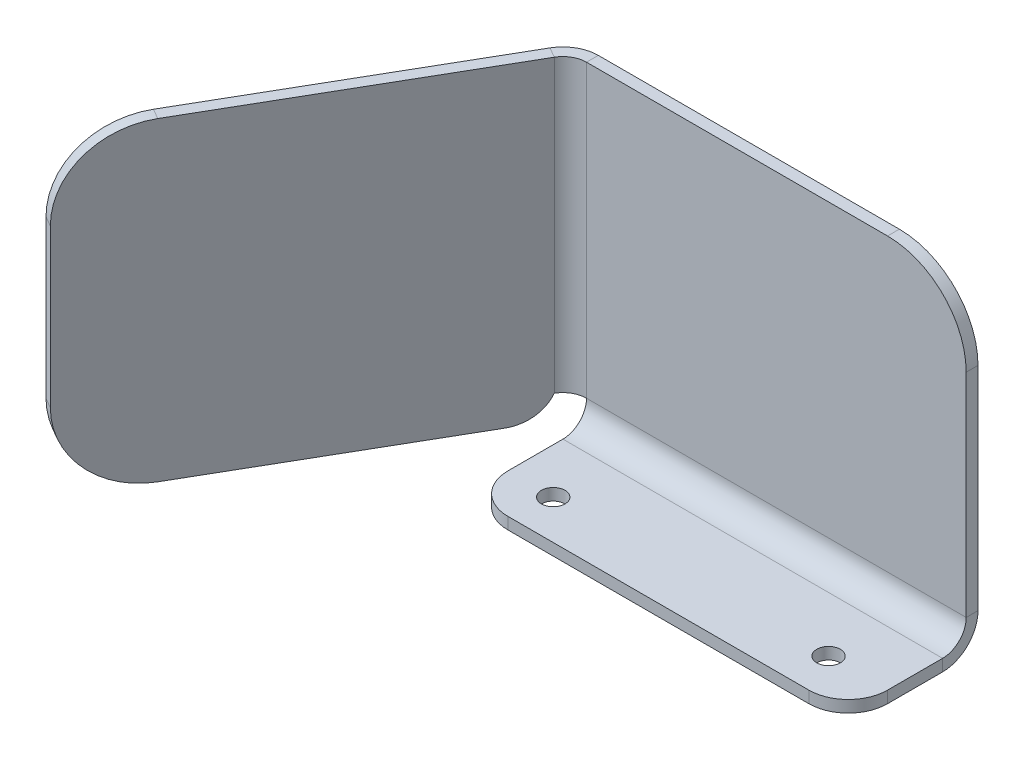
from build123d import *

# Parameters (mm, degrees)
SKETCH1_W                    = 50
SKETCH1_H                    = 40
BASE_FLANGE1_DEPTH           = 1.5
EDGE_FLANGE1_STRIP_CUT_DEPTH = 40
EDGE_FLANGE1_DEPTH           = 40
EDGE_FLANGE2_START           = -25.866025404
EDGE_FLANGE2_DEPTH           = 2.598076212
EDGE_FLANGE2_START_2         = -23.267949192
EDGE_FLANGE2_2_DEPTH         = 48.267949192
EDGE_FLANGE2_3_DEPTH         = 50.866025404
EDGE_FLANGE2_START_3         = -21
EDGE_FLANGE2_4_DEPTH         = 4
SKETCH12_R                   = 1.5
CUT_EXTRUDE1_DEPTH           = 10
FILLET1_R                    = 10
FILLET2_R                    = 5


with BuildPart() as part:
    # Base-Flange1: sheet metal written as solids
    # Sketch1 → Base-Flange1 (new body)
    with BuildSketch(Plane.XY):
        Rectangle(SKETCH1_W, SKETCH1_H)
    extrude(amount=BASE_FLANGE1_DEPTH)

    # Edge-Flange1: sheet metal written as solids
    # Edge-Flange1 strip (on a plane across the edge) → Edge-Flange1 strip cut (cut)
    with BuildSketch(Plane(origin=(-25, 20, 1.5), x_dir=(0.8660254037844364, 0, 0.5000000000000041), z_dir=(0, -1, 0))):
        Polygon((-9.642304845, 3.834936491), (0.75, -2.165063509), (1.5, -0.866025404), (-8.892304845, 5.133974596), align=None)
    extrude(amount=EDGE_FLANGE1_STRIP_CUT_DEPTH, mode=Mode.SUBTRACT)

    # Edge-Flange1 section (on a plane across the edge) → Edge-Flange1 (add)
    with BuildSketch(Plane(origin=(-25, 20, 1.5), x_dir=(0.8660254037844364, 0, 0.5000000000000041), z_dir=(0, -1, 0))):
        with BuildLine():
            Line((-1.5, 1.732050808), (-1.5, 48.633974596))
            Line((-1.5, 48.633974596), (0, 48.633974596))
            Line((0, 48.633974596), (0, 1.732050808))
            ThreePointArc((0, 1.732050808), (0.401923789, 0.232050808), (1.5, -0.866025404))
            Line((1.5, -0.866025404), (0.75, -2.165063509))
            ThreePointArc((0.75, -2.165063509), (-0.897114317, -0.517949192), (-1.5, 1.732050808))
        make_face()
    extrude(amount=EDGE_FLANGE1_DEPTH)

    # Edge-Flange2: read off the stored shape, not the designer's step
    # Edge-Flange2 outline → Edge-Flange2 (cut)
    with BuildSketch(Plane.YZ.offset(EDGE_FLANGE2_START)):
        with BuildLine():
            Line((-17, 0), (-17, 1.5))
            ThreePointArc((-17, 1.5), (-19.121320344, 2.378679656), (-20, 4.5))
            Line((-20, 4.5), (-20, 16.5))
            Line((-20, 16.5), (-21.5, 16.5))
            Line((-21.5, 16.5), (-21.5, 4.5))
            ThreePointArc((-21.5, 4.5), (-21.107919181, 2.662882693), (-20, 1.145898034))
            ThreePointArc((-20, 1.145898034), (-18.605699404, 0.296224385), (-17, 0))
        make_face()
    extrude(amount=EDGE_FLANGE2_DEPTH, mode=Mode.SUBTRACT)

    # Edge-Flange2 2 outline → Edge-Flange2 2 (add)
    with BuildSketch(Plane.YZ.offset(EDGE_FLANGE2_START_2)):
        with BuildLine():
            Line((-17, 0), (-17, 1.5))
            ThreePointArc((-17, 1.5), (-19.121320344, 2.378679656), (-20, 4.5))
            Line((-20, 4.5), (-20, 16.5))
            Line((-20, 16.5), (-21.5, 16.5))
            Line((-21.5, 16.5), (-21.5, 4.5))
            ThreePointArc((-21.5, 4.5), (-21.107919181, 2.662882693), (-20, 1.145898034))
            ThreePointArc((-20, 1.145898034), (-18.605699404, 0.296224385), (-17, 0))
        make_face()
    extrude(amount=EDGE_FLANGE2_2_DEPTH)

    # Edge-Flange2 3 outline → Edge-Flange2 3 (cut)
    with BuildSketch(Plane.YZ.offset(EDGE_FLANGE2_START)):
        with BuildLine():
            ThreePointArc((-17, 0), (-18.605699404, 0.296224385), (-20, 1.145898034))
            Line((-20, 1.145898034), (-20, 0))
            Line((-20, 0), (-17, 0))
        make_face()
    extrude(amount=EDGE_FLANGE2_3_DEPTH, mode=Mode.SUBTRACT)

    # Edge-Flange2 4 outline → Edge-Flange2 4 (cut)
    with BuildSketch(Plane(origin=(0, 0, 0), x_dir=(1, 0, 0), z_dir=(0, 1, 0)).offset(EDGE_FLANGE2_START_3)):
        with BuildLine():
            ThreePointArc((-25.866025404, -3), (-24.767949192, -1.901923789), (-23.267949192, -1.5))
            Line((-23.267949192, -1.5), (-23.267949192, 0))
            ThreePointArc((-23.267949192, 0), (-25.517949192, -0.602885683), (-27.165063509, -2.25))
            Line((-27.165063509, -2.25), (-25.866025404, -3))
        make_face()
    extrude(amount=EDGE_FLANGE2_4_DEPTH, mode=Mode.SUBTRACT)

    # Sketch12 → Cut-Extrude1 (cut)
    with BuildSketch(Plane(origin=(0, -20, 0), x_dir=(1, 0, 0), z_dir=(0, 1, 0))):
        with Locations(Location((-17.5, -11.5, 0), (0, 0, 270))):
            Circle(SKETCH12_R)
        with Locations(Location((17.5, -11.5, 0), (0, 0, 270))):
            Circle(SKETCH12_R)
    extrude(amount=-CUT_EXTRUDE1_DEPTH, mode=Mode.SUBTRACT)

    # Fillet1
    fillet1_edges = [part.edges().sort_by_distance(p)[0] for p in [
        (-49.966506351, 20, 43.243257487),
        (-49.966506351, -20, 43.243257487),
        (25, 20, 0.75),
    ]]
    fillet(fillet1_edges, radius=FILLET1_R)

    # Fillet2
    # the kernel refuses this fillet: 5 mm, written as the material it takes off along each edge
    with BuildSketch(Plane(origin=(-37.086630924, -20, -3.478219621), x_dir=(-0.5000000001953341, 0, 0.8660254036716625), z_dir=(0.8660254036716625, 0, 0.5000000001953341))) as fillet2_piece_1:
        with BuildLine():
            CenterArc((4.582575695, -5), FILLET2_R, 90, 66.421821522)
            Line((0, -3), (0, 0))
            Line((0, 0), (4.582575695, 0))
        make_face()
    extrude(amount=24.412878474, mode=Mode.SUBTRACT)
    with BuildSketch(Plane(origin=(-23.267949192, -7.5, 16.5), x_dir=(1, 0, 0), z_dir=(0, -1, 0)), Plane(origin=(25, -7.5, 16.5), x_dir=(0, 0, -1), z_dir=(0, -1, 0))) as fillet2_piece_2:
        with BuildLine():
            CenterArc((FILLET2_R, -FILLET2_R), FILLET2_R, 90, 90)
            Line((0, -FILLET2_R), (0, 0))
            Line((0, 0), (FILLET2_R, 0))
        make_face()
    extrude(amount=26.5, mode=Mode.SUBTRACT)


solid = part.part
